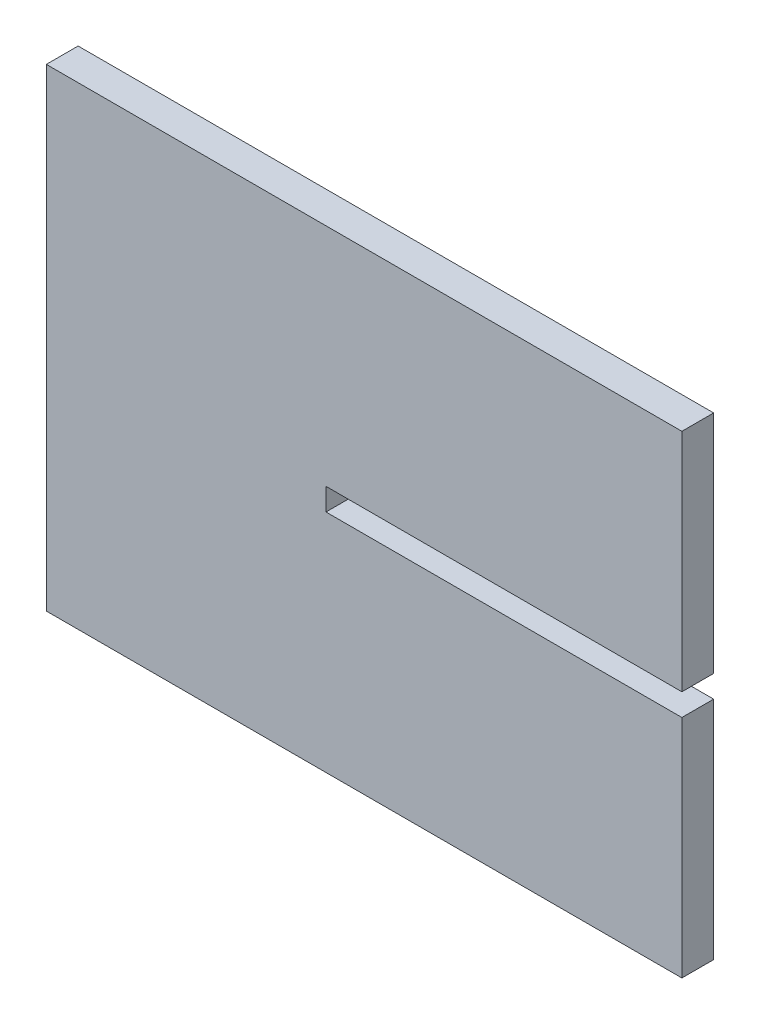
from build123d import *

# Parameters (mm, degrees)
SM_BASE_FLANGE_1_DEPTH = 10


# Sheet-metal steps are written as plain solids
with BuildPart() as part:
    # Sketch 1 → Базовая кромка1 (new body)
    with BuildSketch(Plane.XY):
        Polygon((200, -78), (200, -149), (0, -149), (0, 0), (200, 0), (200, -71), (88, -71), (88, -78), align=None)
    extrude(amount=-SM_BASE_FLANGE_1_DEPTH)


solid = part.part
